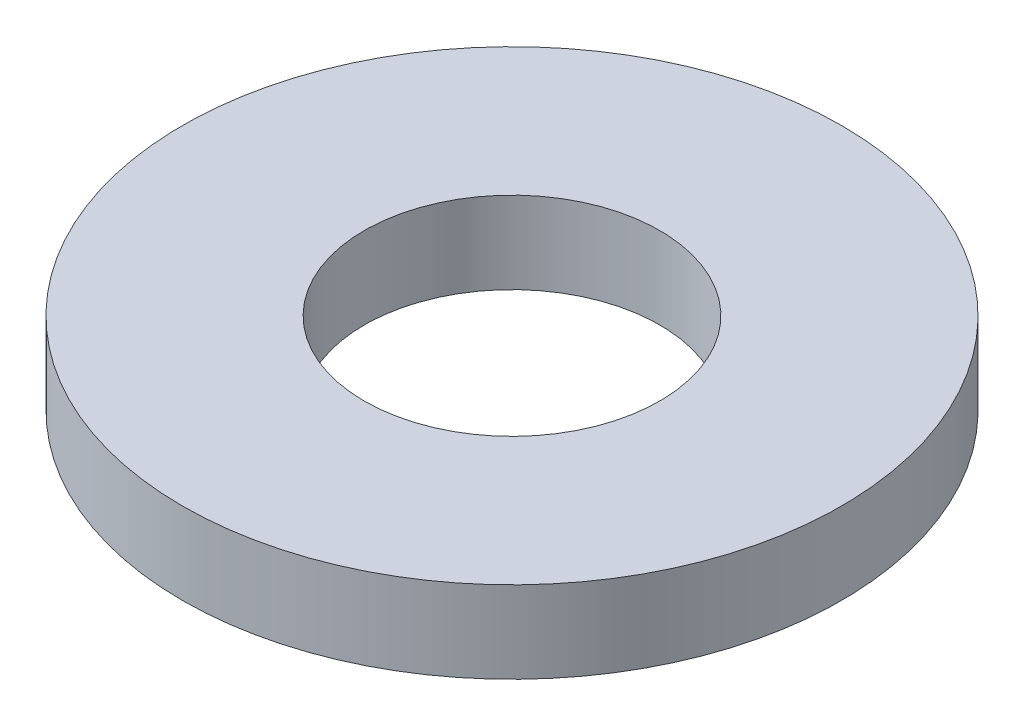
from build123d import *

# Parameters (mm, degrees)
SKETCH1_R           = 72.5
BOSS_EXTRUDE1_DEPTH = 18
SKETCH2_R           = 32.5
CUT_EXTRUDE1_DEPTH  = 105.098511036


with BuildPart() as part:
    # Sketch1 → Boss-Extrude1 (new body)
    with BuildSketch(Plane(origin=(0, 0, 0), x_dir=(1, 0, 0), z_dir=(0, 1, 0))):
        Circle(SKETCH1_R)
    extrude(amount=BOSS_EXTRUDE1_DEPTH)

    # Sketch2 → Cut-Extrude1 (cut, through all)
    with BuildSketch(Plane(origin=(0, 0, 0), x_dir=(1, 0, 0), z_dir=(0, 1, 0))):
        Circle(SKETCH2_R)
    extrude(amount=CUT_EXTRUDE1_DEPTH, mode=Mode.SUBTRACT)


solid = part.part
